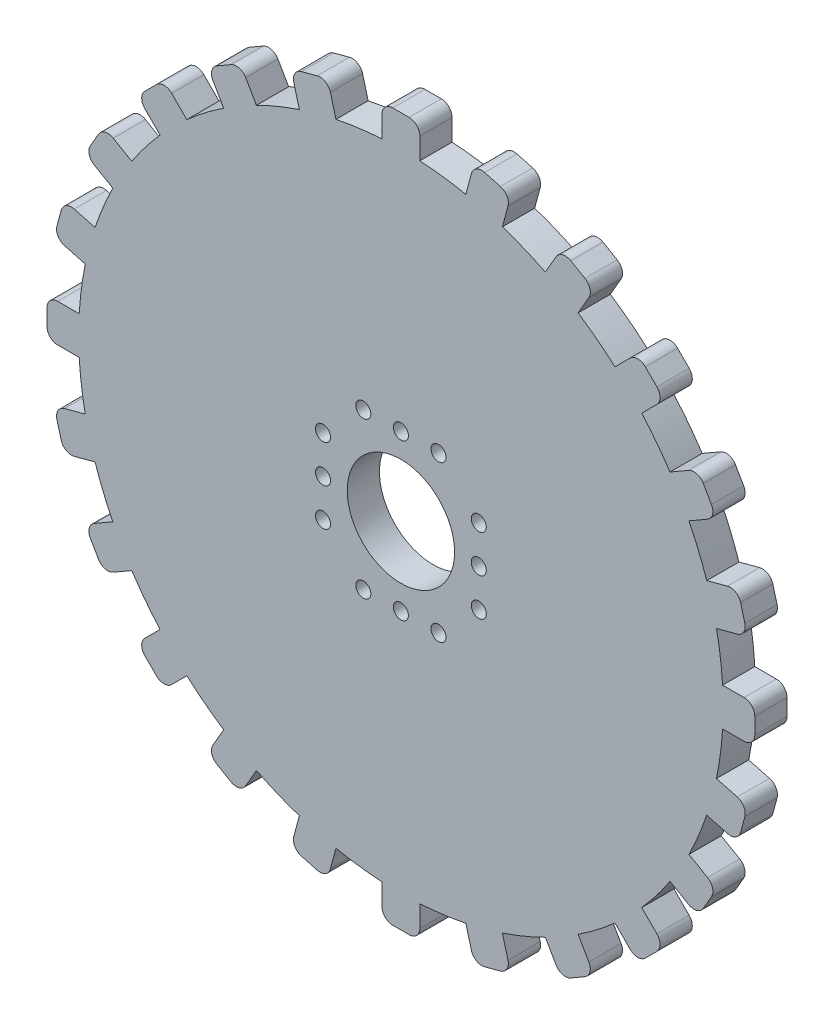
from build123d import *

# Parameters (mm, degrees)
SKETCH1_R           = 30
SKETCH1_R_2         = 5
SKETCH1_R_3         = 0.7
BOSS_EXTRUDE1_DEPTH = 3
BOSS_EXTRUDE2_DEPTH = 3
CIRPATTERN2_COUNT   = 24


with BuildPart() as part:
    # Sketch1 → Boss-Extrude1 (new body)
    with BuildSketch(Plane.XY):
        Circle(SKETCH1_R)
        Circle(SKETCH1_R_2, mode=Mode.SUBTRACT)
        with Locations((-3.5, 7.25)):
            Circle(SKETCH1_R_3, mode=Mode.SUBTRACT)
        with Locations((0, 7.25)):
            Circle(SKETCH1_R_3, mode=Mode.SUBTRACT)
        with Locations((3.5, 7.25)):
            Circle(SKETCH1_R_3, mode=Mode.SUBTRACT)
        with Locations((7.25, 3.5)):
            Circle(SKETCH1_R_3, mode=Mode.SUBTRACT)
        with Locations((7.25, 0)):
            Circle(SKETCH1_R_3, mode=Mode.SUBTRACT)
        with Locations((7.25, -3.5)):
            Circle(SKETCH1_R_3, mode=Mode.SUBTRACT)
        with Locations((3.5, -7.25)):
            Circle(SKETCH1_R_3, mode=Mode.SUBTRACT)
        with Locations((0, -7.25)):
            Circle(SKETCH1_R_3, mode=Mode.SUBTRACT)
        with Locations((-3.5, -7.25)):
            Circle(SKETCH1_R_3, mode=Mode.SUBTRACT)
        with Locations((-7.25, -3.5)):
            Circle(SKETCH1_R_3, mode=Mode.SUBTRACT)
        with Locations((-7.25, 0)):
            Circle(SKETCH1_R_3, mode=Mode.SUBTRACT)
        with Locations((-7.25, 3.5)):
            Circle(SKETCH1_R_3, mode=Mode.SUBTRACT)
    extrude(amount=BOSS_EXTRUDE1_DEPTH)

    # Sketch2 → Boss-Extrude2 (add)
    with BuildSketch(Plane.XY.offset(3)):
        with BuildLine():
            Line((29.948176492, 1.762590363), (31.948176492, 1.762590363))
            ThreePointArc((31.948176492, 1.762590363), (32.655283273, 1.469697144), (32.948176492, 0.762590363))
            Line((32.948176492, 0.762590363), (32.948176492, -0.762590363))
            ThreePointArc((32.948176492, -0.762590363), (32.655283273, -1.469697144), (31.948176492, -1.762590363))
            Line((31.948176492, -1.762590363), (29.948176492, -1.762590363))
            Line((29.948176492, -1.762590363), (29.948176492, 1.762590363))
        make_face()
    boss_extrude2 = extrude(amount=-BOSS_EXTRUDE2_DEPTH)

    # CirPattern2: Boss-Extrude2 ×24 about axis
    cirpattern2_axis = Axis((0, 0, -0.15), (0, 0, 1))
    for i in range(1, CIRPATTERN2_COUNT):
        add(boss_extrude2.rotate(cirpattern2_axis, i * 360 / CIRPATTERN2_COUNT))


solid = part.part
